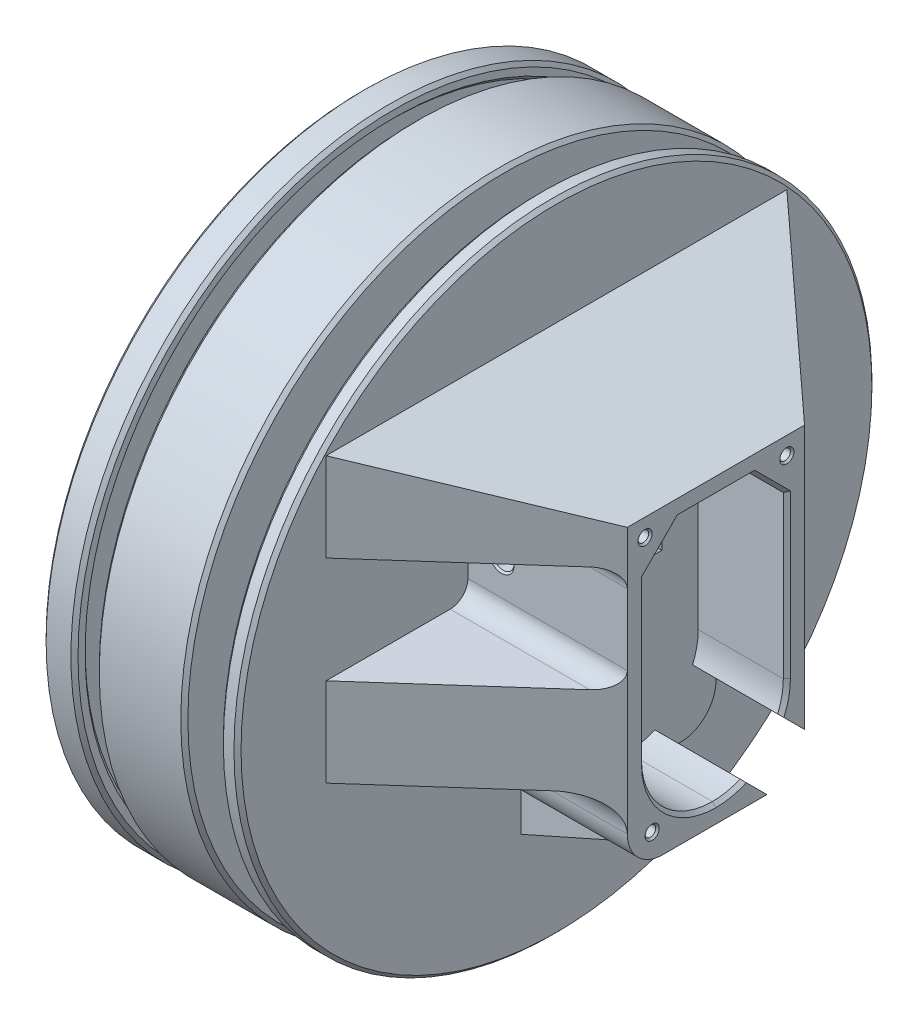
from build123d import *

# Parameters (mm, degrees)
SKETCH_1_W                  = 130
SKETCH_1_H                  = 120
EXTRUDE_1_DEPTH             = 8
SKETCH_3_W                  = 50
SKETCH_3_H                  = 85
EXTRUDE_2_DEPTH             = 20
SKETCH_4_W                  = 17.5
SKETCH_4_H                  = 17.5
CUT_EXTRUDE_1_DEPTH         = 19
SKETCH_5_R                  = 3
CUT_EXTRUDE_2_DEPTH         = 112.731821788
SKETCH_6_W                  = 50
SKETCH_6_H                  = 85
SKETCH_6_W_2                = 40
SKETCH_6_H_2                = 75
EXTRUDE_3_DEPTH             = 25
CHAMFER_1_SIZE              = 9.5
FILLET_1_R                  = 20
CUT_EXTRUDE_3_DEPTH         = 104.121287812
CUT_EXTRUDE_3_DEPTH_BACK    = 25
CHAMFER_2_SIZE              = 1
CHAMFER_3_SIZE              = 1
EXTRUDE_START               = -40
EXTRUDE_4_DEPTH             = 25
EXTRUDE_5_REACH             = 105.121
EXTRUDE_5_DIRECTION_2_REACH = 105.121
EXTRUDE_6_DEPTH             = 10
EXTRUDE_6_DEPTH_BACK        = 10
FILLET_2_R                  = 10
CUT_EXTRUDE_4_DEPTH         = 104.121287812
CUT_EXTRUDE_4_DEPTH_BACK    = 20
SKETCH_11_R                 = 1.5
CHAMFER_4_SIZE              = 0.5
SKETCH_13_W                 = 150
SKETCH_13_H                 = 220
SKETCH_13_W_2               = 130
SKETCH_13_H_2               = 120
EXTRUDE_7_DEPTH             = 8
FILLET_4_R                  = 10
SKETCH_15_R                 = 2.75
CUT_EXTRUDE_6_DEPTH         = 141.534693226
FILLET_5_R                  = 4
EXTRUDE_8_DEPTH             = 10
FILLET_6_R                  = 5
CHAMFER_5_SIZE              = 0.5
CUT_EXTRUDE_START           = -8
CUT_EXTRUDE_7_DEPTH         = 8
SKETCH_18_R                 = 90
EXTRUDE_9_DEPTH             = 5
SKETCH_19_R                 = 70
EXTRUDE_10_DEPTH            = 10
SKETCH_20_R                 = 90
EXTRUDE_11_DEPTH            = 25
SKETCH_24_R                 = 75
EXTRUDE_14_DEPTH            = 10
SKETCH_25_R                 = 90
EXTRUDE_15_DEPTH            = 5
EXTRUDE_START_2             = 4
SKETCH_26_R                 = 90
SKETCH_26_R_2               = 86
EXTRUDE_16_DEPTH            = 4
SKETCH_27_R                 = 2.75
CUT_EXTRUDE_8_DEPTH         = 20
CHAMFER_6_SIZE              = 1
CHAMFER_7_SIZE              = 1
SKETCH_28_W                 = 17.5
SKETCH_28_H                 = 17.5
CUT_EXTRUDE_9_DEPTH         = 0.5


# Some blends are built 0.0001 mm under size
with BuildPart() as part:
    # 草图1 → 凸台-拉伸1 (new body)
    with BuildSketch(Plane(origin=(0, 0, 0), x_dir=(0, 0, -1), z_dir=(1, 0, 0))):
        Rectangle(SKETCH_1_W, SKETCH_1_H)
    extrude(amount=EXTRUDE_1_DEPTH)

    # 草图3 → 凸台-拉伸2 (add)
    with BuildSketch(Plane(origin=(8, 0, 0), x_dir=(0, 0, -1), z_dir=(1, 0, 0))):
        with Locations((0, 2.5)):
            Rectangle(SKETCH_3_W, SKETCH_3_H)
    extrude(amount=EXTRUDE_2_DEPTH)

    # 草图4 → 切除-拉伸1 (cut)
    with BuildSketch(Plane(origin=(28, 0, 0), x_dir=(0, 0, -1), z_dir=(1, 0, 0))):
        with Locations((0, 19.25)):
            Rectangle(SKETCH_4_W, SKETCH_4_H)
    extrude(amount=-CUT_EXTRUDE_1_DEPTH, mode=Mode.SUBTRACT)

    # 草图5 → 切除-拉伸2 (cut, through all)
    with BuildSketch(Plane(origin=(0, 0, -25), x_dir=(-1, 0, 0), z_dir=(0, 0, -1))):
        with Locations(Location((-17.5, 19.5, 0), (0, 0, 90))):
            Circle(SKETCH_5_R)
    extrude(amount=-CUT_EXTRUDE_2_DEPTH, mode=Mode.SUBTRACT)

    # 草图6 → 凸台-拉伸3 (add)
    with BuildSketch(Plane(origin=(28, 0, 0), x_dir=(0, 0, -1), z_dir=(1, 0, 0))):
        with Locations((0, 2.5)):
            Rectangle(SKETCH_6_W, SKETCH_6_H)
        with Locations((0, 2.5)):
            Rectangle(SKETCH_6_W_2, SKETCH_6_H_2, mode=Mode.SUBTRACT)
    extrude(amount=EXTRUDE_3_DEPTH)

    # 倒角1
    chamfer_1_edges = [part.edges().sort_by_distance(p)[0] for p in [
        (40.5, 40, 20),
        (40.5, 40, -20),
    ]]
    chamfer(chamfer_1_edges, length=CHAMFER_1_SIZE)

    # 圆角1
    fillet_1_edges = [part.edges().sort_by_distance(p)[0] for p in [
        (40.5, -35, 20),
        (40.5, -35, -20),
    ]]
    fillet(fillet_1_edges, radius=FILLET_1_R - 0.0001)  # a hair under: the kernel refuses the full size

    # 草图7 → 切除-拉伸3 (cut, two sides: drawn at the far end of the back side and taken through both)
    with BuildSketch(Plane(origin=(53, 0, 0), x_dir=(0, 0, -1), z_dir=(1, 0, 0)).offset(-CUT_EXTRUDE_3_DEPTH_BACK)):
        Polygon((6.01040764, -31.617009358), (16.617009358, -21.01040764), (32.173358544, -36.566756826), (21.566756826, -47.173358544), align=None)
    extrude(amount=CUT_EXTRUDE_3_DEPTH + CUT_EXTRUDE_3_DEPTH_BACK, mode=Mode.SUBTRACT)

    # 倒角2
    chamfer_2_edges = [part.edges().sort_by_distance(p)[0] for p in [
        (28, 19.25, 8.75),
        (28, 10.5, 0),
        (28, 19.25, -8.75),
        (28, 28, 0),
    ]]
    chamfer(chamfer_2_edges, length=CHAMFER_2_SIZE)

    # 倒角3
    chamfer_3_edges = [part.edges().sort_by_distance(p)[0] for p in [
        (53, -34.599345679, -3.983260659),
        (53, 40, 0),
        (53, 7.74995, 20),
        (53, 35.25, 15.25),
        (53, 35.25, -15.25),
        (53, 7.74995, -20),
        (53, -29.142164913, 14.142164913),
        (53, -18.983260659, -19.599345679),
    ]]
    chamfer(chamfer_3_edges, length=CHAMFER_3_SIZE)

    # 草图8 → 凸台-拉伸4 (add)
    with BuildSketch(Plane(origin=(0, 45, 0), x_dir=(1, 0, 0), z_dir=(0, 1, 0)).offset(EXTRUDE_START)):
        Polygon((53, -25), (8, -65), (8, -25), align=None)
        Polygon((8, 25), (53, 25), (8, 65), align=None)
    extrude(amount=-EXTRUDE_4_DEPTH)

    # 凸台-拉伸5: up to this plane
    extrude_5_end = Plane(origin=(53, -20, 25), z_dir=(0.6643638388299199, 0, 0.7474093186836597))
    # 草图9 → 凸台-拉伸5 (add, up to the surface)
    with BuildSketch(Plane.XY, mode=Mode.PRIVATE) as extrude_5_sk1:
        Polygon((53, 45), (8, 60), (8, 45), align=None)
    extrude_5_tool1 = split(extrude(extrude_5_sk1.sketch, amount=EXTRUDE_5_REACH, mode=Mode.PRIVATE), bisect_by=extrude_5_end, keep=Keep.BOTH, mode=Mode.PRIVATE)
    add(extrude_5_tool1.solids().sort_by_distance((23, 50, 0))[0])

    # 凸台-拉伸5 direction 2: up to this plane
    extrude_5_direction_2_end = Plane(origin=(53, -20, -25), z_dir=(0.6643638388299199, 0, -0.7474093186836597))
    # 草图9 → 凸台-拉伸5 direction 2 (add, up to the surface)
    with BuildSketch(Plane.XY, mode=Mode.PRIVATE) as extrude_5_direction_2_sk1:
        Polygon((53, 45), (8, 60), (8, 45), align=None)
    extrude_5_direction_2_tool1 = split(extrude(extrude_5_direction_2_sk1.sketch, amount=-EXTRUDE_5_DIRECTION_2_REACH, mode=Mode.PRIVATE), bisect_by=extrude_5_direction_2_end, keep=Keep.BOTH, mode=Mode.PRIVATE)
    add(extrude_5_direction_2_tool1.solids().sort_by_distance((23, 50, 0))[0])

    # 草图10 → 凸台-拉伸6 (add, two sides: drawn at the far end of the back side and taken through both)
    with BuildSketch(Plane.XY.offset(-EXTRUDE_6_DEPTH_BACK)):
        Polygon((8, -60), (53, -40), (8, -40), align=None)
    extrude(amount=EXTRUDE_6_DEPTH + EXTRUDE_6_DEPTH_BACK)

    # 圆角2
    fillet_2_edges = [part.edges().sort_by_distance(p)[0] for p in [
        (18, -40, -25),
        (30.5, -40, 25),
    ]]
    fillet(fillet_2_edges, radius=FILLET_2_R)

    # 草图11 → 切除-拉伸4 (cut, two sides: drawn at the far end of the back side and taken through both)
    with BuildSketch(Plane(origin=(53, 0, 0), x_dir=(0, 0, -1), z_dir=(1, 0, 0)).offset(-CUT_EXTRUDE_4_DEPTH_BACK)):
        with Locations(Location((20, 40, 0), (0, 0, 180))):
            Circle(SKETCH_11_R)
        with Locations(Location((-18, -33, 0), (0, 0, 180))):
            Circle(SKETCH_11_R)
        with Locations(Location((-20, 40, 0), (0, 0, 180))):
            Circle(SKETCH_11_R)
    extrude(amount=CUT_EXTRUDE_4_DEPTH + CUT_EXTRUDE_4_DEPTH_BACK, mode=Mode.SUBTRACT)

    # 倒角4
    chamfer_4_edges = [part.edges().sort_by_distance(p)[0] for p in [
        (53, 40, -21.5),
        (53, -33, 16.5),
        (53, 40, 18.5),
    ]]
    chamfer(chamfer_4_edges, length=CHAMFER_4_SIZE)

    # 草图13 → 凸台-拉伸7 (add)
    with BuildSketch(Plane.ZY):
        Rectangle(SKETCH_13_W, SKETCH_13_H)
        Rectangle(SKETCH_13_W_2, SKETCH_13_H_2, mode=Mode.SUBTRACT)
    extrude(amount=-EXTRUDE_7_DEPTH)

    # 圆角4
    # the kernel refuses this fillet: 10 mm, written as the material it adds along each edge
    with BuildSketch(Plane(origin=(8, -20, 25), x_dir=(0, -1, 0), z_dir=(1, 0, 0))) as fillet_4_piece_1_section:
        with BuildLine():
            CenterArc((FILLET_4_R, -FILLET_4_R), FILLET_4_R, 90, 90)
            Line((0, -FILLET_4_R), (0, 0))
            Line((0, 0), (FILLET_4_R, 0))
        make_face()
    fillet_4_piece_1 = extrude(amount=45, mode=Mode.PRIVATE)
    fillet_4_piece_1 = split(fillet_4_piece_1, bisect_by=Plane(origin=(38.692278555, -22.336167514, 37.717974618), z_dir=(-0.6643638388299199, 0, -0.7474093186836597)), keep=Keep.TOP, mode=Mode.PRIVATE)
    add(fillet_4_piece_1)
    with BuildSketch(Plane(origin=(8, -20, -25), x_dir=(0, -1, 0), z_dir=(1, 0, 0))) as fillet_4_piece_2_section:
        with BuildLine():
            CenterArc((FILLET_4_R, FILLET_4_R), FILLET_4_R, 180, 90)
            Line((0, FILLET_4_R), (0, 0))
            Line((0, 0), (FILLET_4_R, 0))
        make_face()
    fillet_4_piece_2 = extrude(amount=45, mode=Mode.PRIVATE)
    fillet_4_piece_2 = split(fillet_4_piece_2, bisect_by=Plane(origin=(28, -29.642059418, -24.897986041), z_dir=(-1, 0, 0)), keep=Keep.TOP, mode=Mode.PRIVATE)
    fillet_4_piece_2 = split(fillet_4_piece_2, bisect_by=Plane(origin=(18, -29.466721871, -25.073323589), z_dir=(0, -0.7071067811865479, 0.7071067811865474)), keep=Keep.TOP, mode=Mode.PRIVATE)
    add(fillet_4_piece_2)
    with BuildSketch(Plane(origin=(8, -20, -25), x_dir=(0, -1, 0), z_dir=(1, 0, 0))) as fillet_4_piece_3_section:
        with BuildLine():
            CenterArc((FILLET_4_R, FILLET_4_R), FILLET_4_R, 180, 90)
            Line((0, FILLET_4_R), (0, 0))
            Line((0, 0), (FILLET_4_R, 0))
        make_face()
    fillet_4_piece_3 = extrude(amount=45, mode=Mode.PRIVATE)
    fillet_4_piece_3 = split(fillet_4_piece_3, bisect_by=Plane(origin=(28, -22.221791928, -27.277470493), z_dir=(-1, 0, 0)), keep=Keep.TOP, mode=Mode.PRIVATE)
    fillet_4_piece_3 = split(fillet_4_piece_3, bisect_by=Plane(origin=(18, -26.946330352, -22.552932069), z_dir=(0, 0.7071067811865479, -0.7071067811865474)), keep=Keep.TOP, mode=Mode.PRIVATE)
    add(fillet_4_piece_3)
    with BuildSketch(Plane(origin=(8, -20, -25), x_dir=(0, -1, 0), z_dir=(1, 0, 0))) as fillet_4_piece_4_section:
        with BuildLine():
            CenterArc((FILLET_4_R, FILLET_4_R), FILLET_4_R, 180, 90)
            Line((0, FILLET_4_R), (0, 0))
            Line((0, 0), (FILLET_4_R, 0))
        make_face()
    fillet_4_piece_4 = extrude(amount=45, mode=Mode.PRIVATE)
    fillet_4_piece_4 = split(fillet_4_piece_4, bisect_by=Plane(origin=(44.356152586, -22.354399004, -32.683419923), z_dir=(-0.6643638388299199, 0, 0.7474093186836597)), keep=Keep.TOP, mode=Mode.PRIVATE)
    fillet_4_piece_4 = split(fillet_4_piece_4, bisect_by=Plane(origin=(28, -22.354399004, -27.045541077), z_dir=(1, 0, 0)), keep=Keep.TOP, mode=Mode.PRIVATE)
    fillet_4_piece_4 = split(fillet_4_piece_4, bisect_by=Plane(origin=(39.344704724, -26.896669182, -22.503270899), z_dir=(0, 0.7071067811865479, -0.7071067811865474)), keep=Keep.TOP, mode=Mode.PRIVATE)
    add(fillet_4_piece_4)

    # 草图15 → 切除-拉伸6 (cut, through all)
    with BuildSketch(Plane(origin=(8, 0, 0), x_dir=(0, 0, -1), z_dir=(1, 0, 0))):
        with Locations((0, 90)):
            Circle(SKETCH_15_R)
        with Locations((50, 90)):
            Circle(SKETCH_15_R)
        with Locations((-50, 90)):
            Circle(SKETCH_15_R)
        with Locations(Location((-50, -90, 0), (0, 0, 180))):
            Circle(SKETCH_15_R)
        with Locations(Location((50, -90, 0), (0, 0, 180))):
            Circle(SKETCH_15_R)
        with Locations(Location((0, -90, 0), (0, 0, 180))):
            Circle(SKETCH_15_R)
    extrude(amount=-CUT_EXTRUDE_6_DEPTH, mode=Mode.SUBTRACT)

    # 圆角5
    fillet_5_edges = [part.edges().sort_by_distance(p)[0] for p in [
        (4, -110, -75),
        (4, 110, -75),
        (4, 110, 75),
        (4, -110, 75),
    ]]
    fillet(fillet_5_edges, radius=FILLET_5_R)

    # 草图16 → 凸台-拉伸8 (add)
    with BuildSketch(Plane.XZ.offset(-45)):
        Polygon((8, -65), (53, -25), (8, -25), align=None)
        Polygon((8, 65), (8, 25), (53, 25), align=None)
    extrude(amount=EXTRUDE_8_DEPTH)

    # 圆角6
    # the kernel refuses this fillet: 5 mm, written as the material it adds along each edge
    with BuildSketch(Plane(origin=(-4.5, 5, 25), x_dir=(0, 0, 1), z_dir=(1, 0, 0))) as fillet_6_piece_1_section:
        with BuildLine():
            CenterArc((FILLET_6_R, -FILLET_6_R), FILLET_6_R, 90, 90)
            Line((0, -FILLET_6_R), (0, 0))
            Line((0, 0), (FILLET_6_R, 0))
        make_face()
    fillet_6_piece_1 = extrude(amount=70, mode=Mode.PRIVATE)
    fillet_6_piece_1 = split(fillet_6_piece_1, bisect_by=Plane(origin=(0, 6.130138069, 26.094234361), z_dir=(1, 0, 0)), keep=Keep.TOP, mode=Mode.PRIVATE)
    fillet_6_piece_1 = split(fillet_6_piece_1, bisect_by=Plane(origin=(39.543855675, 6.130138069, 36.961017178), z_dir=(-0.6643638388297957, 0, -0.74740931868377)), keep=Keep.TOP, mode=Mode.PRIVATE)
    add(fillet_6_piece_1)
    with BuildSketch(Plane(origin=(-4.5, 5, -25), x_dir=(0, 1, 0), z_dir=(1, 0, 0))) as fillet_6_piece_2_section:
        with BuildLine():
            CenterArc((FILLET_6_R, -FILLET_6_R), FILLET_6_R, 90, 90)
            Line((0, -FILLET_6_R), (0, 0))
            Line((0, 0), (FILLET_6_R, 0))
        make_face()
    fillet_6_piece_2 = extrude(amount=70, mode=Mode.PRIVATE)
    fillet_6_piece_2 = split(fillet_6_piece_2, bisect_by=Plane(origin=(0, 6.130138069, -26.094234361), z_dir=(1, 0, 0)), keep=Keep.TOP, mode=Mode.PRIVATE)
    fillet_6_piece_2 = split(fillet_6_piece_2, bisect_by=Plane(origin=(39.543855675, 6.130138069, -36.961017178), z_dir=(-0.6643638388297957, 0, 0.74740931868377)), keep=Keep.TOP, mode=Mode.PRIVATE)
    add(fillet_6_piece_2)
    with BuildSketch(Plane(origin=(65.5, 35, -25), x_dir=(0, 0, -1), z_dir=(-1, 0, 0))) as fillet_6_piece_3_section:
        with BuildLine():
            CenterArc((FILLET_6_R, FILLET_6_R), FILLET_6_R, 180, 90)
            Line((0, FILLET_6_R), (0, 0))
            Line((0, 0), (FILLET_6_R, 0))
        make_face()
    fillet_6_piece_3 = extrude(amount=70, mode=Mode.PRIVATE)
    fillet_6_piece_3 = split(fillet_6_piece_3, bisect_by=Plane(origin=(0, 33.869861931, -26.094234361), z_dir=(1, 0, 0)), keep=Keep.TOP, mode=Mode.PRIVATE)
    fillet_6_piece_3 = split(fillet_6_piece_3, bisect_by=Plane(origin=(39.543855675, 33.869861931, -36.961017178), z_dir=(-0.6643638388299199, 0, 0.7474093186836597)), keep=Keep.TOP, mode=Mode.PRIVATE)
    add(fillet_6_piece_3)
    with BuildSketch(Plane(origin=(-4.5, 35, 25), x_dir=(0, -1, 0), z_dir=(1, 0, 0))) as fillet_6_piece_4_section:
        with BuildLine():
            CenterArc((FILLET_6_R, -FILLET_6_R), FILLET_6_R, 90, 90)
            Line((0, -FILLET_6_R), (0, 0))
            Line((0, 0), (FILLET_6_R, 0))
        make_face()
    fillet_6_piece_4 = extrude(amount=70, mode=Mode.PRIVATE)
    fillet_6_piece_4 = split(fillet_6_piece_4, bisect_by=Plane(origin=(0, 33.869861931, 26.094234361), z_dir=(1, 0, 0)), keep=Keep.TOP, mode=Mode.PRIVATE)
    fillet_6_piece_4 = split(fillet_6_piece_4, bisect_by=Plane(origin=(39.543855675, 33.869861931, 36.961017178), z_dir=(-0.66436383882992, 0, -0.7474093186836596)), keep=Keep.TOP, mode=Mode.PRIVATE)
    add(fillet_6_piece_4)

    # 倒角5
    chamfer_5_edges = [part.edges().sort_by_distance(p)[0] for p in [
        (17.5, 16.5, 25),
        (17.5, 16.5, -25),
    ]]
    chamfer(chamfer_5_edges, length=CHAMFER_5_SIZE)

    # 草图17 → 切除-拉伸7 (cut)
    with BuildSketch(Plane.ZY.offset(CUT_EXTRUDE_START)):
        with BuildLine():
            Line((75, -106), (75, 106))
            ThreePointArc((75, 106), (73.828427125, 108.828427125), (71, 110))
            Line((71, 110), (-71, 110))
            ThreePointArc((-71, 110), (-73.828427125, 108.828427125), (-75, 106))
            Line((-75, 106), (-75, -106))
            ThreePointArc((-75, -106), (-73.828427125, -108.828427125), (-71, -110))
            Line((-71, -110), (71, -110))
            ThreePointArc((71, -110), (73.828427125, -108.828427125), (75, -106))
        make_face()
    extrude(amount=CUT_EXTRUDE_7_DEPTH, mode=Mode.SUBTRACT)

    # 草图18 → 凸台-拉伸9 (add)
    with BuildSketch(Plane.ZY.offset(-8)):
        Circle(SKETCH_18_R)
    extrude(amount=EXTRUDE_9_DEPTH)

    # 草图19 → 凸台-拉伸10 (add)
    with BuildSketch(Plane.ZY.offset(-3)):
        Circle(SKETCH_19_R)
    extrude(amount=EXTRUDE_10_DEPTH)

    # 草图20 → 凸台-拉伸11 (add)
    with BuildSketch(Plane.ZY.offset(7)):
        Circle(SKETCH_20_R)
    extrude(amount=EXTRUDE_11_DEPTH)

    # 草图24 → 凸台-拉伸14 (add)
    with BuildSketch(Plane.ZY.offset(32)):
        Circle(SKETCH_24_R)
    extrude(amount=EXTRUDE_14_DEPTH)

    # 草图25 → 凸台-拉伸15 (add)
    with BuildSketch(Plane.ZY.offset(42)):
        Circle(SKETCH_25_R)
    extrude(amount=EXTRUDE_15_DEPTH)

    # 草图26 → 凸台-拉伸16 (add)
    with BuildSketch(Plane(origin=(-42, 0, 0), x_dir=(0, 0, -1), z_dir=(1, 0, 0)).offset(EXTRUDE_START_2)):
        with Locations(Location((0, 0, 0), (0, 0, 180))):
            Circle(SKETCH_26_R)
        Circle(SKETCH_26_R_2, mode=Mode.SUBTRACT)
    extrude(amount=-EXTRUDE_16_DEPTH)

    # 草图27 → 切除-拉伸8 (cut)
    with BuildSketch(Plane.ZY.offset(47)):
        with Locations((-40, 60)):
            Circle(SKETCH_27_R)
        with Locations((-40, 0)):
            Circle(SKETCH_27_R)
        with Locations((-40, -60)):
            Circle(SKETCH_27_R)
        with Locations(Location((40, -60, 0), (0, 0, 180))):
            Circle(SKETCH_27_R)
        with Locations(Location((40, 0, 0), (0, 0, 180))):
            Circle(SKETCH_27_R)
        with Locations(Location((40, 60, 0), (0, 0, 180))):
            Circle(SKETCH_27_R)
    extrude(amount=-CUT_EXTRUDE_8_DEPTH, mode=Mode.SUBTRACT)

    # 倒角6
    chamfer_6_edges = [part.edges().sort_by_distance(p)[0] for p in [
        (-47, 60, 42.75),
        (-47, 0, 42.75),
        (-47, -60, 42.75),
        (-47, -60, -42.75),
        (-47, 0, -42.75),
        (-47, 60, -42.75),
    ]]
    chamfer(chamfer_6_edges, length=CHAMFER_6_SIZE)

    # 倒角7
    chamfer_7_edges = [part.edges().sort_by_distance(p)[0] for p in [
        (8, 0, -90),
        (3, 0, -90),
        (-7, 0, -90),
        (-32, 0, -90),
        (-47, 0, -90),
        (-38, 0, -90),
        (-38, 0, 86),
    ]]
    chamfer(chamfer_7_edges, length=CHAMFER_7_SIZE)

    # 草图28 → 切除-拉伸9 (cut)
    with BuildSketch(Plane(origin=(9, 0, 0), x_dir=(0, 0, -1), z_dir=(1, 0, 0))):
        with Locations((0, 19.25)):
            Rectangle(SKETCH_28_W, SKETCH_28_H)
    extrude(amount=-CUT_EXTRUDE_9_DEPTH, mode=Mode.SUBTRACT)


solid = part.part
